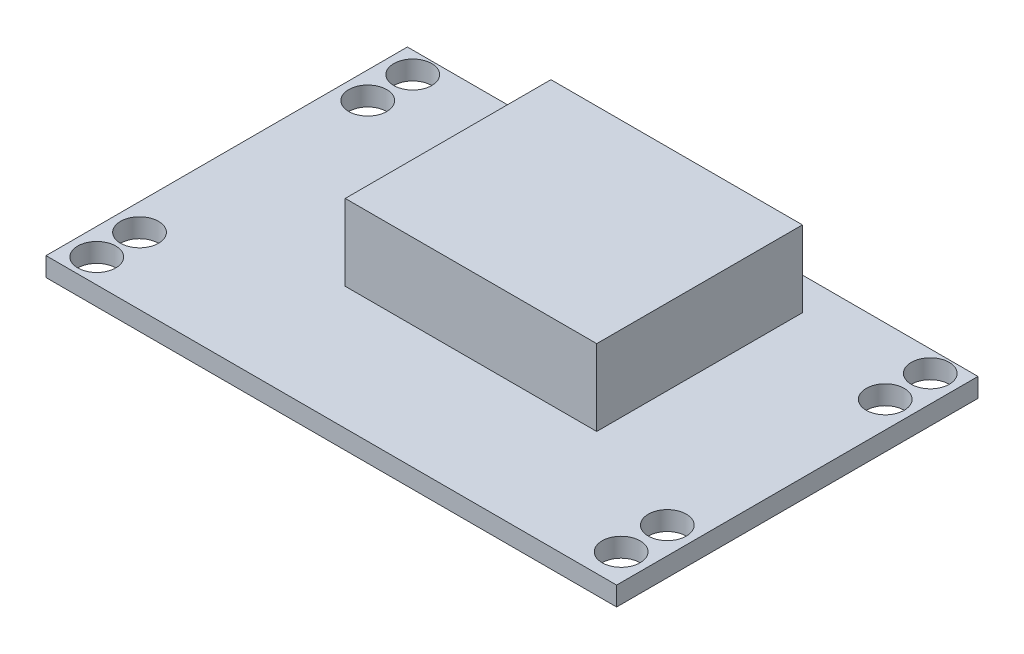
from build123d import *

# Parameters (mm, degrees)
SKETCH1_W           = 30
SKETCH1_H           = 19
BOSS_EXTRUDE1_DEPTH = 1
SKETCH2_W           = 13.222286428
SKETCH2_H           = 10.81458632
BOSS_EXTRUDE2_DEPTH = 4
SKETCH3_R           = 1
CUT_EXTRUDE1_DEPTH  = 36.73513677


with BuildPart() as part:
    # Sketch1 → Boss-Extrude1 (new body)
    with BuildSketch(Plane(origin=(0, 0, 0), x_dir=(1, 0, 0), z_dir=(0, 1, 0))):
        with Locations((15, 9.5)):
            Rectangle(SKETCH1_W, SKETCH1_H)
    extrude(amount=BOSS_EXTRUDE1_DEPTH)

    # Sketch2 → Boss-Extrude2 (add)
    with BuildSketch(Plane(origin=(0, 1, 0), x_dir=(1, 0, 0), z_dir=(0, 1, 0))):
        with Locations((15.872791289, 11.877603857)):
            Rectangle(SKETCH2_W, SKETCH2_H)
    extrude(amount=BOSS_EXTRUDE2_DEPTH)

    # Sketch3 → Cut-Extrude1 (cut, through all)
    with BuildSketch(Plane(origin=(0, 1, 0), x_dir=(1, 0, 0), z_dir=(0, 1, 0))):
        with Locations((1.396494389, 17.886822044)):
            Circle(SKETCH3_R)
        with Locations((1.396494389, 15.519250271)):
            Circle(SKETCH3_R)
        with Locations((1.396494389, 3.520878065)):
            Circle(SKETCH3_R)
        with Locations((1.396494389, 1.273691297)):
            Circle(SKETCH3_R)
        with Locations((28.603505611, 1.634846313)):
            Circle(SKETCH3_R)
        with Locations((28.603505611, 4.062610589)):
            Circle(SKETCH3_R)
        with Locations((28.603505611, 17.886822044)):
            Circle(SKETCH3_R)
        with Locations((28.603505611, 15.519250271)):
            Circle(SKETCH3_R)
    extrude(amount=-CUT_EXTRUDE1_DEPTH, mode=Mode.SUBTRACT)


solid = part.part
